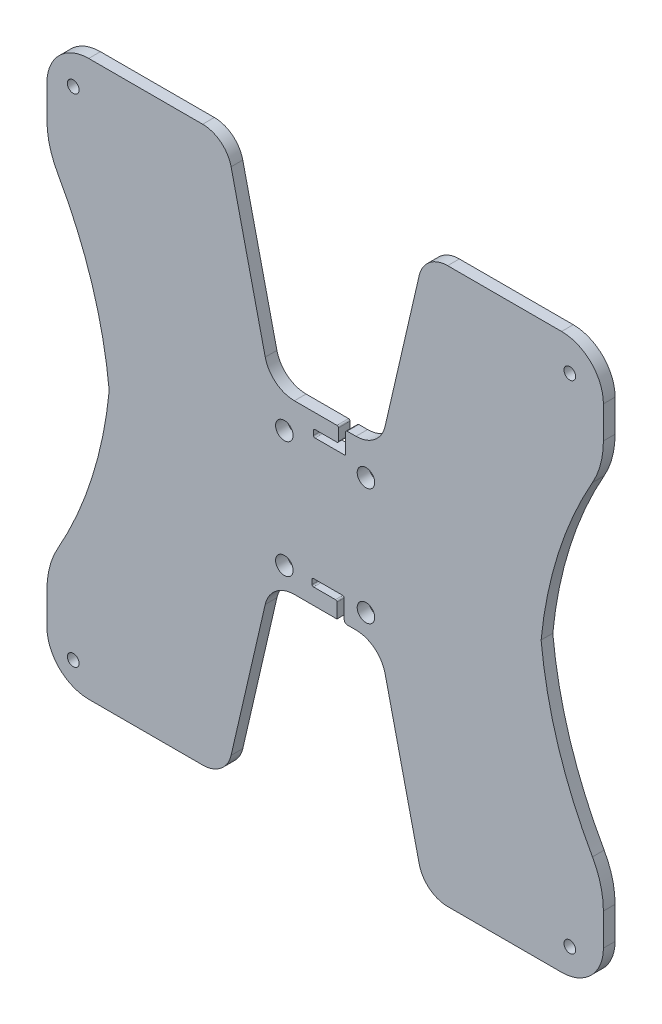
from build123d import *

# Parameters (mm, degrees)
BOSS_EXTRUDE1_DEPTH = 4
SKETCH3_R           = 2
SKETCH3_R_2         = 3
CUT_EXTRUDE1_DEPTH  = 4


with BuildPart() as part:
    # Sketch2 → Boss-Extrude1 (new body)
    with BuildSketch(Plane.XY):
        with BuildLine():
            Line((94.375415976, -52.704406223), (94.375415976, -56.704406223))
            ThreePointArc((94.375415976, -56.704406223), (94.228969367, -57.057959614), (93.875415976, -57.204406223))
            Line((93.875415976, -57.204406223), (86.375415976, -57.204406223))
            ThreePointArc((86.375415976, -57.204406223), (86.021862586, -57.350852833), (85.875415976, -57.704406223))
            Line((85.875415976, -57.704406223), (85.875415976, -59.204406223))
            ThreePointArc((85.875415976, -59.204406223), (86.021862586, -59.557959614), (86.375415976, -59.704406223))
            Line((86.375415976, -59.704406223), (96.375415976, -59.704406223))
            ThreePointArc((96.375415976, -59.704406223), (96.728969367, -59.557959614), (96.875415976, -59.204406223))
            Line((96.875415976, -59.204406223), (96.875415976, -52.704406223))
            ThreePointArc((96.875415976, -52.704406223), (97.021862586, -52.350852833), (97.375415976, -52.204406223))
            Line((97.375415976, -52.204406223), (100.375415976, -52.204406223))
            ThreePointArc((100.375415976, -52.204406223), (106.756191002, -49.976139831), (110.36270914, -44.260154531))
            Line((110.36270914, -44.260154531), (122.04253828, 6.330743606))
            ThreePointArc((122.04253828, 6.330743606), (125.561092562, 11.907314631), (131.786238928, 14.081233063))
            Line((131.786238928, 14.081233063), (170.7844924, 14.081233063))
            ThreePointArc((170.7844924, 14.081233063), (180.903868338, 9.889650306), (185.095451094, -0.229725632))
            Line((185.095451094, -0.229725632), (185.095451094, -11.229725632))
            ThreePointArc((185.095451094, -11.229725632), (184.144121557, -18.570812299), (181.352982104, -25.42691337))
            ThreePointArc((181.352982104, -25.42691337), (169.65700257, -52.25234878), (163.771733482, -80.918766937))
            ThreePointArc((163.771733482, -80.918766937), (169.65700257, -109.585185095), (181.352982104, -136.410620505))
            ThreePointArc((181.352982104, -136.410620505), (184.144121557, -143.266721576), (185.095451094, -150.607808243))
            Line((185.095451094, -150.607808243), (185.095451094, -161.607808243))
            ThreePointArc((185.095451094, -161.607808243), (180.903868338, -171.727184181), (170.7844924, -175.918766937))
            Line((170.7844924, -175.918766937), (131.786238928, -175.918766937))
            ThreePointArc((131.786238928, -175.918766937), (125.561092562, -173.744848506), (122.04253828, -168.168277481))
            Line((122.04253828, -168.168277481), (110.36270914, -117.577379344))
            ThreePointArc((110.36270914, -117.577379344), (106.756191002, -111.861394044), (100.375415976, -109.633127651))
            Line((100.375415976, -109.633127651), (97.375415976, -109.633127651))
            ThreePointArc((97.375415976, -109.633127651), (96.668309195, -109.340234433), (96.375415976, -108.633127651))
            Line((96.375415976, -108.633127651), (96.375415976, -102.133127651))
            ThreePointArc((96.375415976, -102.133127651), (96.228969367, -101.779574261), (95.875415976, -101.633127651))
            Line((95.875415976, -101.633127651), (85.875415976, -101.633127651))
            ThreePointArc((85.875415976, -101.633127651), (85.521862586, -101.779574261), (85.375415976, -102.133127651))
            Line((85.375415976, -102.133127651), (85.375415976, -103.633127651))
            ThreePointArc((85.375415976, -103.633127651), (85.521862586, -103.986681042), (85.875415976, -104.133127651))
            Line((85.875415976, -104.133127651), (93.375415976, -104.133127651))
            ThreePointArc((93.375415976, -104.133127651), (93.728969367, -104.279574261), (93.875415976, -104.633127651))
            Line((93.875415976, -104.633127651), (93.875415976, -108.633127651))
            Line((93.875415976, -108.633127651), (93.875415976, -109.633127651))
            Line((93.875415976, -109.633127651), (82.315486211, -109.633127651))
            Line((82.315486211, -109.633127651), (79.315486211, -109.633127651))
            ThreePointArc((79.315486211, -109.633127651), (72.934711186, -111.861394044), (69.328193047, -117.577379344))
            Line((69.328193047, -117.577379344), (57.648363907, -168.168277481))
            ThreePointArc((57.648363907, -168.168277481), (54.129809626, -173.744848506), (47.904663259, -175.918766937))
            Line((47.904663259, -175.918766937), (8.906409788, -175.918766937))
            ThreePointArc((8.906409788, -175.918766937), (-1.21296615, -171.727184181), (-5.404548906, -161.607808243))
            Line((-5.404548906, -161.607808243), (-5.404548906, -150.607808243))
            ThreePointArc((-5.404548906, -150.607808243), (-4.453219369, -143.266721576), (-1.662079916, -136.410620505))
            ThreePointArc((-1.662079916, -136.410620505), (10.033899618, -109.585185095), (15.919168706, -80.918766937))
            ThreePointArc((15.919168706, -80.918766937), (10.033899618, -52.25234878), (-1.662079916, -25.42691337))
            ThreePointArc((-1.662079916, -25.42691337), (-4.453219369, -18.570812299), (-5.404548906, -11.229725632))
            Line((-5.404548906, -11.229725632), (-5.404548906, -0.229725632))
            ThreePointArc((-5.404548906, -0.229725632), (-1.21296615, 9.889650306), (8.906409788, 14.081233063))
            Line((8.906409788, 14.081233063), (47.904663259, 14.081233063))
            ThreePointArc((47.904663259, 14.081233063), (54.129809626, 11.907314631), (57.648363907, 6.330743606))
            Line((57.648363907, 6.330743606), (69.328193047, -44.260154531))
            ThreePointArc((69.328193047, -44.260154531), (72.934711186, -49.976139831), (79.315486211, -52.204406223))
            Line((79.315486211, -52.204406223), (82.315486211, -52.204406223))
            Line((82.315486211, -52.204406223), (93.875415976, -52.204406223))
            ThreePointArc((93.875415976, -52.204406223), (94.228969367, -52.350852833), (94.375415976, -52.704406223))
        make_face()
    extrude(amount=BOSS_EXTRUDE1_DEPTH)

    # Sketch3 → Cut-Extrude1 (cut)
    with BuildSketch(Plane.XY.offset(4)):
        with Locations((3.595451094, 3.081233063)):
            Circle(SKETCH3_R)
        with Locations((3.595451094, -166.918766937)):
            Circle(SKETCH3_R)
        with Locations((75.875451094, -62.741886603)):
            Circle(SKETCH3_R_2)
        with Locations((103.815451094, -62.741886603)):
            Circle(SKETCH3_R_2)
        with Locations((75.875451094, -102.741886603)):
            Circle(SKETCH3_R_2)
        with Locations((103.815451094, -102.741886603)):
            Circle(SKETCH3_R_2)
        with Locations((173.595451094, -166.918766937)):
            Circle(SKETCH3_R)
        with Locations((173.595451094, 3.081233063)):
            Circle(SKETCH3_R)
    extrude(amount=-CUT_EXTRUDE1_DEPTH, mode=Mode.SUBTRACT)


solid = part.part
